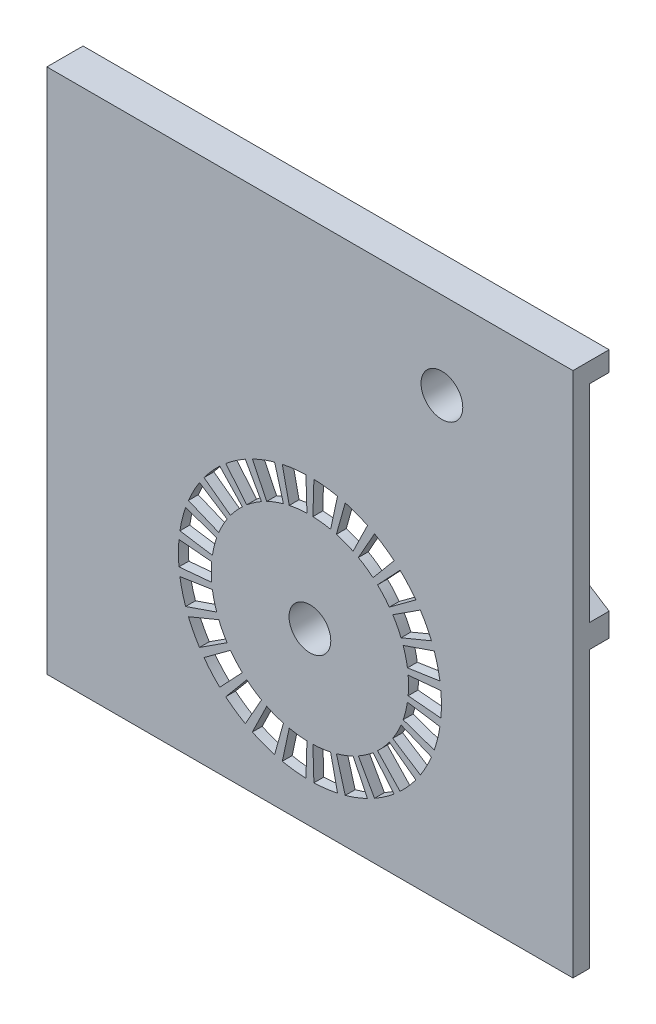
from build123d import *

# Parameters (mm, degrees)
LED_PANEL_W                           = 80
LED_PANEL_H                           = 80
EXTRUDE_LED_PANEL_DEPTH               = 2.5
SKETCH3_R                             = 5.998748594
SKETCH3_R_2                           = 6.002880514
BOSS_EXTRUDE2_DEPTH                   = 7
SKETCH1_R                             = 3.175
CUT_ARROW_INDICATION_HOLES_DEPTH      = 58
CUT_HOLE_FOR_SECONDARY_ROD_DEPTH      = 57.747246629
CUT_HOLE_FOR_SECONDARY_ROD_DEPTH_BACK = 7
SKETCH4_R                             = 3.175
CUT_START                             = -1
SKETCH2_R                             = 5.998748594
CUT_SLOT_FOR_PCB_DEPTH                = 1
BOSS_EXTRUDE3_DEPTH                   = 3


with BuildPart() as part:
    # LED panel → Extrude LED panel (new body)
    with BuildSketch(Plane.XY):
        Rectangle(LED_PANEL_W, LED_PANEL_H)
    extrude(amount=EXTRUDE_LED_PANEL_DEPTH)

    # Sketch3 → Boss-Extrude2 (add)
    with BuildSketch(Plane.XY.offset(2.5)):
        with Locations((0, -14)):
            Circle(SKETCH3_R)
        with Locations((20.072118416, 26.780555807)):
            Circle(SKETCH3_R_2)
    extrude(amount=-BOSS_EXTRUDE2_DEPTH)

    # Sketch1 → Cut arrow indication holes (cut, through all)
    with BuildSketch(Plane.XY.offset(2.5)):
        with Locations((0, -14)):
            Circle(SKETCH1_R)
        with BuildLine():
            Line((14.938448364, -12.642516863), (19.917931152, -12.190022483))
            ThreePointArc((19.917931152, -12.190022483), (20, -14), (19.917931152, -15.809977517))
            Line((19.917931152, -15.809977517), (14.938448364, -15.357483137))
            ThreePointArc((14.938448364, -15.357483137), (15, -14), (14.938448364, -12.642516863))
        make_face()
        with BuildLine():
            Line((14.829231183, -16.256967549), (19.772308244, -17.009290065))
            ThreePointArc((19.772308244, -17.009290065), (19.418836349, -18.786313286), (18.905996301, -20.524055784))
            Line((18.905996301, -20.524055784), (14.179497226, -18.893041838))
            ThreePointArc((14.179497226, -18.893041838), (14.564127261, -17.589734964), (14.829231183, -16.256967549))
        make_face()
        with BuildLine():
            Line((13.858192988, -19.740251485), (18.47759065, -21.653668647))
            ThreePointArc((18.47759065, -21.653668647), (17.709120513, -23.294463441), (16.795313665, -24.858979644))
            Line((16.795313665, -24.858979644), (12.596485248, -22.144234733))
            ThreePointArc((12.596485248, -22.144234733), (13.281840385, -20.970847581), (13.858192988, -19.740251485))
        make_face()
        with BuildLine():
            Line((12.081766988, -22.88993287), (16.109022651, -25.853243827))
            ThreePointArc((16.109022651, -25.853243827), (14.970214963, -27.262453165), (13.708548447, -28.562819078))
            Line((13.708548447, -28.562819078), (10.281411335, -24.922114308))
            ThreePointArc((10.281411335, -24.922114308), (11.227661223, -23.946839874), (12.081766988, -22.88993287))
        make_face()
        with BuildLine():
            Line((9.603192607, -25.522963671), (12.804256809, -29.363951561))
            ThreePointArc((12.804256809, -29.363951561), (11.361294935, -30.459677318), (9.825092222, -31.4203204))
            Line((9.825092222, -31.4203204), (7.368819166, -27.0652403))
            ThreePointArc((7.368819166, -27.0652403), (8.520971201, -26.344757988), (9.603192607, -25.522963671))
        make_face()
        with BuildLine():
            Line((6.566515577, -27.486321706), (8.755354103, -31.981762275))
            ThreePointArc((8.755354103, -31.981762275), (7.092097741, -32.700324854), (5.370637349, -33.265416021))
            Line((5.370637349, -33.265416021), (4.027978012, -28.449062016))
            ThreePointArc((4.027978012, -28.449062016), (5.319073306, -28.02524364), (6.566515577, -27.486321706))
        make_face()
        with BuildLine():
            Line((3.148216531, -28.665903746), (4.197622041, -33.554538327))
            ThreePointArc((4.197622041, -33.554538327), (2.410733605, -33.854177482), (0.604060556, -33.99087569))
            Line((0.604060556, -33.99087569), (0.453045417, -28.993156767))
            ThreePointArc((0.453045417, -28.993156767), (1.808050204, -28.890633111), (3.148216531, -28.665903746))
        make_face()
        with BuildLine():
            Line((-0.453045417, -28.993156767), (-0.604060556, -33.99087569))
            ThreePointArc((-0.604060556, -33.99087569), (-2.410733605, -33.854177482), (-4.197622041, -33.554538327))
            Line((-4.197622041, -33.554538327), (-3.148216531, -28.665903746))
            ThreePointArc((-3.148216531, -28.665903746), (-1.808050204, -28.890633111), (-0.453045417, -28.993156767))
        make_face()
        with BuildLine():
            Line((-4.027978012, -28.449062016), (-5.370637349, -33.265416021))
            ThreePointArc((-5.370637349, -33.265416021), (-7.092097741, -32.700324854), (-8.755354103, -31.981762275))
            Line((-8.755354103, -31.981762275), (-6.566515577, -27.486321706))
            ThreePointArc((-6.566515577, -27.486321706), (-5.319073306, -28.02524364), (-4.027978012, -28.449062016))
        make_face()
        with BuildLine():
            Line((-7.368819166, -27.0652403), (-9.825092222, -31.4203204))
            ThreePointArc((-9.825092222, -31.4203204), (-11.361294935, -30.459677318), (-12.804256809, -29.363951561))
            Line((-12.804256809, -29.363951561), (-9.603192607, -25.522963671))
            ThreePointArc((-9.603192607, -25.522963671), (-8.520971201, -26.344757988), (-7.368819166, -27.0652403))
        make_face()
        with BuildLine():
            Line((-10.281411335, -24.922114308), (-13.708548447, -28.562819078))
            ThreePointArc((-13.708548447, -28.562819078), (-14.970214963, -27.262453165), (-16.109022651, -25.853243827))
            Line((-16.109022651, -25.853243827), (-12.081766988, -22.88993287))
            ThreePointArc((-12.081766988, -22.88993287), (-11.227661223, -23.946839874), (-10.281411335, -24.922114308))
        make_face()
        with BuildLine():
            Line((-12.596485248, -22.144234733), (-16.795313665, -24.858979644))
            ThreePointArc((-16.795313665, -24.858979644), (-17.709120513, -23.294463441), (-18.47759065, -21.653668647))
            Line((-18.47759065, -21.653668647), (-13.858192988, -19.740251485))
            ThreePointArc((-13.858192988, -19.740251485), (-13.281840385, -20.970847581), (-12.596485248, -22.144234733))
        make_face()
        with BuildLine():
            Line((-14.179497226, -18.893041838), (-18.905996301, -20.524055784))
            ThreePointArc((-18.905996301, -20.524055784), (-19.418836349, -18.786313286), (-19.772308244, -17.009290065))
            Line((-19.772308244, -17.009290065), (-14.829231183, -16.256967549))
            ThreePointArc((-14.829231183, -16.256967549), (-14.564127261, -17.589734964), (-14.179497226, -18.893041838))
        make_face()
        with BuildLine():
            Line((-14.938448364, -15.357483137), (-19.917931152, -15.809977517))
            ThreePointArc((-19.917931152, -15.809977517), (-20, -14), (-19.917931152, -12.190022483))
            Line((-19.917931152, -12.190022483), (-14.938448364, -12.642516863))
            ThreePointArc((-14.938448364, -12.642516863), (-15, -14), (-14.938448364, -15.357483137))
        make_face()
        with BuildLine():
            Line((-14.829231183, -11.743032451), (-19.772308244, -10.990709935))
            ThreePointArc((-19.772308244, -10.990709935), (-19.418836349, -9.213686714), (-18.905996301, -7.475944216))
            Line((-18.905996301, -7.475944216), (-14.179497226, -9.106958162))
            ThreePointArc((-14.179497226, -9.106958162), (-14.564127261, -10.410265036), (-14.829231183, -11.743032451))
        make_face()
        with BuildLine():
            Line((-13.858192988, -8.259748515), (-18.47759065, -6.346331353))
            ThreePointArc((-18.47759065, -6.346331353), (-17.709120513, -4.705536559), (-16.795313665, -3.141020356))
            Line((-16.795313665, -3.141020356), (-12.596485248, -5.855765267))
            ThreePointArc((-12.596485248, -5.855765267), (-13.281840385, -7.029152419), (-13.858192988, -8.259748515))
        make_face()
        with BuildLine():
            Line((-12.081766988, -5.11006713), (-16.109022651, -2.146756173))
            ThreePointArc((-16.109022651, -2.146756173), (-14.970214963, -0.737546835), (-13.708548447, 0.562819078))
            Line((-13.708548447, 0.562819078), (-10.281411335, -3.077885692))
            ThreePointArc((-10.281411335, -3.077885692), (-11.227661223, -4.053160126), (-12.081766988, -5.11006713))
        make_face()
        with BuildLine():
            Line((-9.603192607, -2.477036329), (-12.804256809, 1.363951561))
            ThreePointArc((-12.804256809, 1.363951561), (-11.361294935, 2.459677318), (-9.825092222, 3.4203204))
            Line((-9.825092222, 3.4203204), (-7.368819166, -0.9347597))
            ThreePointArc((-7.368819166, -0.9347597), (-8.520971201, -1.655242012), (-9.603192607, -2.477036329))
        make_face()
        with BuildLine():
            Line((-6.566515577, -0.513678294), (-8.755354103, 3.981762275))
            ThreePointArc((-8.755354103, 3.981762275), (-7.092097741, 4.700324854), (-5.370637349, 5.265416021))
            Line((-5.370637349, 5.265416021), (-4.027978012, 0.449062016))
            ThreePointArc((-4.027978012, 0.449062016), (-5.319073306, 0.02524364), (-6.566515577, -0.513678294))
        make_face()
        with BuildLine():
            Line((-3.148216531, 0.665903746), (-4.197622041, 5.554538327))
            ThreePointArc((-4.197622041, 5.554538327), (-2.410733605, 5.854177482), (-0.604060556, 5.99087569))
            Line((-0.604060556, 5.99087569), (-0.453045417, 0.993156767))
            ThreePointArc((-0.453045417, 0.993156767), (-1.808050204, 0.890633111), (-3.148216531, 0.665903746))
        make_face()
        with BuildLine():
            Line((0.453045417, 0.993156767), (0.604060556, 5.99087569))
            ThreePointArc((0.604060556, 5.99087569), (2.410733605, 5.854177482), (4.197622041, 5.554538327))
            Line((4.197622041, 5.554538327), (3.148216531, 0.665903746))
            ThreePointArc((3.148216531, 0.665903746), (1.808050204, 0.890633111), (0.453045417, 0.993156767))
        make_face()
        with BuildLine():
            Line((4.027978012, 0.449062016), (5.370637349, 5.265416021))
            ThreePointArc((5.370637349, 5.265416021), (7.092097741, 4.700324854), (8.755354103, 3.981762275))
            Line((8.755354103, 3.981762275), (6.566515577, -0.513678294))
            ThreePointArc((6.566515577, -0.513678294), (5.319073306, 0.02524364), (4.027978012, 0.449062016))
        make_face()
        with BuildLine():
            Line((7.368819166, -0.9347597), (9.825092222, 3.4203204))
            ThreePointArc((9.825092222, 3.4203204), (11.361294935, 2.459677318), (12.804256809, 1.363951561))
            Line((12.804256809, 1.363951561), (9.603192607, -2.477036329))
            ThreePointArc((9.603192607, -2.477036329), (8.520971201, -1.655242012), (7.368819166, -0.9347597))
        make_face()
        with BuildLine():
            Line((10.281411335, -3.077885692), (13.708548447, 0.562819078))
            ThreePointArc((13.708548447, 0.562819078), (14.970214963, -0.737546835), (16.109022651, -2.146756173))
            Line((16.109022651, -2.146756173), (12.081766988, -5.11006713))
            ThreePointArc((12.081766988, -5.11006713), (11.227661223, -4.053160126), (10.281411335, -3.077885692))
        make_face()
        with BuildLine():
            Line((12.596485248, -5.855765267), (16.795313665, -3.141020356))
            ThreePointArc((16.795313665, -3.141020356), (17.709120513, -4.705536559), (18.47759065, -6.346331353))
            Line((18.47759065, -6.346331353), (13.858192988, -8.259748515))
            ThreePointArc((13.858192988, -8.259748515), (13.281840385, -7.029152419), (12.596485248, -5.855765267))
        make_face()
        with BuildLine():
            Line((14.179497226, -9.106958162), (18.905996301, -7.475944216))
            ThreePointArc((18.905996301, -7.475944216), (19.418836349, -9.213686714), (19.772308244, -10.990709935))
            Line((19.772308244, -10.990709935), (14.829231183, -11.743032451))
            ThreePointArc((14.829231183, -11.743032451), (14.564127261, -10.410265036), (14.179497226, -9.106958162))
        make_face()
    extrude(amount=-CUT_ARROW_INDICATION_HOLES_DEPTH, mode=Mode.SUBTRACT)

    # Sketch4 → Cut hole for secondary rod (cut, two sides: drawn at the far end of the back side and taken through both)
    with BuildSketch(Plane.XY.offset(-CUT_HOLE_FOR_SECONDARY_ROD_DEPTH_BACK)):
        with Locations((20.072118416, 26.780555807)):
            Circle(SKETCH4_R)
    extrude(amount=CUT_HOLE_FOR_SECONDARY_ROD_DEPTH + CUT_HOLE_FOR_SECONDARY_ROD_DEPTH_BACK, mode=Mode.SUBTRACT)

    # Sketch2 → Cut slot for PCB (cut)
    with BuildSketch(Plane(origin=(0, 0, 0), x_dir=(-1, 0, 0), z_dir=(0, 0, -1)).offset(CUT_START)):
        with BuildLine():
            Line((-1, 13.481812167), (-1, 14.981812167))
            Line((-1, 14.981812167), (1, 14.981812167))
            Line((1, 14.981812167), (1, 13.481812167))
            ThreePointArc((1, 13.481812167), (27.200508752, -9.952491679), (8.958236434, -40))
            Line((8.958236434, -40), (-8.958236434, -40))
            ThreePointArc((-8.958236434, -40), (-27.200508752, -9.952491679), (-1, 13.481812167))
        make_face()
        with Locations((0, -14)):
            Circle(SKETCH2_R, mode=Mode.SUBTRACT)
    extrude(amount=CUT_SLOT_FOR_PCB_DEPTH, mode=Mode.SUBTRACT)

    # Sketch6 → Boss-Extrude3 (add)
    with BuildSketch(Plane(origin=(0, 0, 0), x_dir=(-1, 0, 0), z_dir=(0, 0, -1))):
        Polygon((-40, 40), (40, 40), (40, 37), (14.471436817, 37), (-40, 1.998731966), (-40, 5.56467809), (8.921860477, 37), (-40, 37), align=None)
    extrude(amount=BOSS_EXTRUDE3_DEPTH)


solid = part.part
